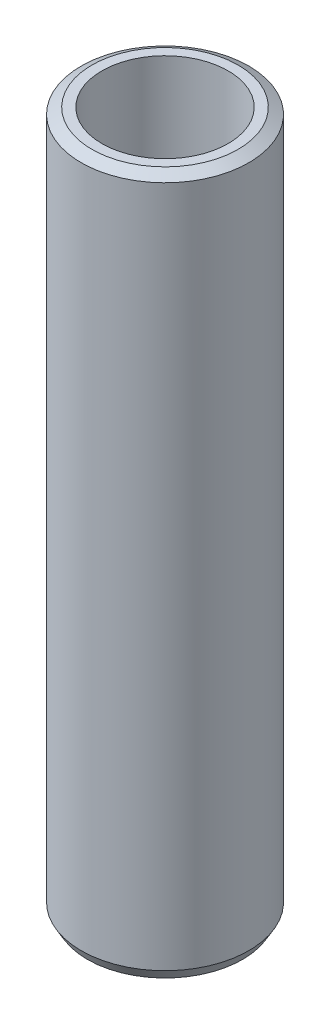
from build123d import *
from OCP.BRepFilletAPI import BRepFilletAPI_MakeChamfer

# Parameters (mm, degrees)
SKETCH1_R           = 57.5
BOSS_EXTRUDE1_DEPTH = 479.742255737
SKETCH2_R           = 43.285910968
CUT_EXTRUDE1_DEPTH  = 487.585174394
CHAMFER1_SIZE       = 4.24821157
CHAMFER1_SIZE2      = 7.358118281


with BuildPart() as part:
    # Sketch1 → Boss-Extrude1 (new body)
    with BuildSketch(Plane(origin=(0, 0, 0), x_dir=(1, 0, 0), z_dir=(0, 1, 0))):
        Circle(SKETCH1_R)
    extrude(amount=BOSS_EXTRUDE1_DEPTH)

    # Sketch2 → Cut-Extrude1 (cut, through all)
    with BuildSketch(Plane(origin=(0, 0, 0), x_dir=(1, 0, 0), z_dir=(0, 1, 0))):
        Circle(SKETCH2_R)
    extrude(amount=CUT_EXTRUDE1_DEPTH, mode=Mode.SUBTRACT)

    # Chamfer1: one chamfer whose edges measure the first distance from different faces: ONE call of the kernel's chamfer builder (chamfer() names one face for all edges)
    chamfer1_edges_1 = [part.edges().sort_by_distance(p)[0] for p in [
        (-57.5, 479.742255737, 0),
    ]]
    chamfer1_side_1 = [part.faces().sort_by_distance(p)[0] for p in [
        (-57.5, 239.871127868, 0),
    ]]
    chamfer1_edges_2 = [part.edges().sort_by_distance(p)[0] for p in [
        (-57.5, 0, 0),
    ]]
    chamfer1_side_2 = [part.faces().sort_by_distance(p)[0] for p in [
        (-55.873654403, 0, 0),
    ]]
    chamfer1 = BRepFilletAPI_MakeChamfer(part.part.solid().wrapped)
    for e in chamfer1_edges_1:
        chamfer1.Add(CHAMFER1_SIZE, CHAMFER1_SIZE2, e.wrapped, chamfer1_side_1[0].wrapped)  # the first distance lies on this face
    for e in chamfer1_edges_2:
        chamfer1.Add(CHAMFER1_SIZE, CHAMFER1_SIZE2, e.wrapped, chamfer1_side_2[0].wrapped)  # the first distance lies on this face
    add(Compound.cast(chamfer1.Shape()), mode=Mode.REPLACE)


solid = part.part
